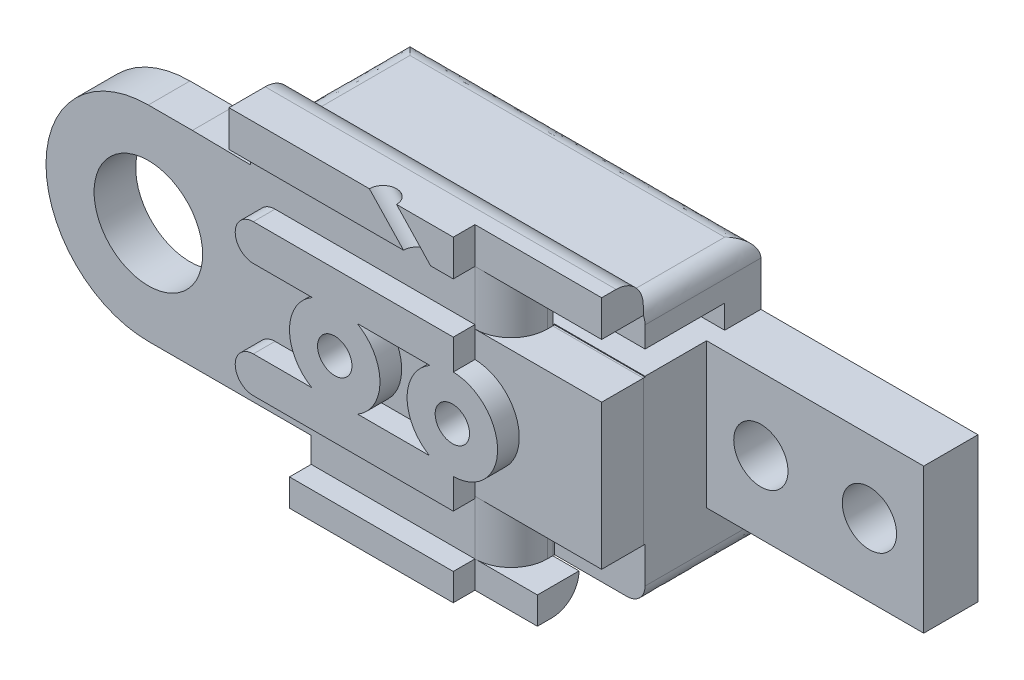
from build123d import *

# Parameters (mm, degrees)
BOSS_EXTRUDE1_DEPTH      = 2
BOSS_EXTRUDE6_DEPTH      = 4.5
CUT_EXTRUDE6_DEPTH       = 4.5
BOSS_EXTRUDE14_DEPTH     = 2.3
SKETCH32_R               = 3
CUT_EXTRUDE7_DEPTH       = 2.3
SKETCH33_W               = 12.393398282201806
SKETCH33_H               = 2.000000000000001
BOSS_EXTRUDE15_DEPTH     = 1.2
CUT_EXTRUDE8_DEPTH       = 2.4
SKETCH43_R               = 2.5000000000000004
SKETCH43_R_2             = 2.4999999999999982
BOSS_EXTRUDE17_DEPTH     = 1.2
CUT_EXTRUDE11_DEPTH      = 29.420773915365164
CUT_EXTRUDE11_DEPTH_BACK = 29.420773915365164
SKETCH44_R               = 0.9499999999999992
SKETCH44_R_2             = 0.9500000000000008
SKETCH49_R               = 0.7500000000000021
CUT_EXTRUDE13_DEPTH      = 3
FILLET1_R                = 1.5
FILLET3_START            = -1
FILLET3_DEPTH            = 8
FILLET3_START_2          = 5
FILLET3_2_DEPTH          = 21
FILLET3_3_DEPTH          = 8
SKETCH45_R               = 1.9999999999999996
SKETCH45_R_2             = 2.000000000000003
CUT_EXTRUDE15_DEPTH      = 4
FILLET4_R                = 2
BOSS_EXTRUDE18_DEPTH     = 12
SKETCH52_R               = 1.500000000000004
SKETCH52_R_2             = 1.5000000000000007
CUT_EXTRUDE16_DEPTH      = 12


with BuildPart() as part:
    # Sketch3 → Boss-Extrude1 (new body)
    with BuildSketch(Plane.XY):
        with BuildLine():
            Line((8.000000000000002, 0), (8.999999999999995, -2.5431457505076205))
            Line((8.999999999999995, -2.5431457505076205), (8.999999999999995, -7.043145750507605))
            Line((8.999999999999995, -7.043145750507605), (21.50000000000004, -7.043145750507604))
            Line((21.50000000000004, -7.043145750507604), (25.05025253169418, -7.043145750507604))
            Line((25.05025253169418, -7.043145750507604), (25.050252531694177, 7.456854249492383))
            Line((25.050252531694177, 7.456854249492383), (5.656854249492373, 7.456854249492379))
            Line((5.656854249492373, 7.456854249492379), (5.656854249492376, 5.656854249492382))
            ThreePointArc((5.656854249492376, 5.656854249492382), (7.391036260090296, 3.061467458920721), (8.000000000000002, 0))
        make_face()
    extrude(amount=BOSS_EXTRUDE1_DEPTH)

    # Sketch22 → Boss-Extrude6 (add)
    with BuildSketch(Plane.XY.offset(2)):
        with BuildLine():
            Line((5.656854249492378, 7.456854249492383), (21.500000000000025, 7.456854249492383))
            Line((21.500000000000025, 7.456854249492383), (25.050252531694177, 7.456854249492383))
            Line((25.050252531694177, 7.456854249492383), (25.05025253169418, -7.043145750507604))
            Line((25.05025253169418, -7.043145750507604), (8.999999999999995, -7.043145750507605))
            Line((8.999999999999995, -7.043145750507605), (8.999999999999995, -2.5431457505076205))
            Line((8.999999999999995, -2.5431457505076205), (7.999999999999998, 0))
            ThreePointArc((7.999999999999998, 0), (7.391036260090291, 3.061467458920719), (5.656854249492376, 5.656854249492382))
            Line((5.656854249492376, 5.656854249492382), (5.656854249492378, 7.456854249492383))
        make_face()
    extrude(amount=BOSS_EXTRUDE6_DEPTH)

    # Sketch26 → Cut-Extrude6 (cut)
    with BuildSketch(Plane.XY.offset(2)):
        Polygon((18.098080447707712, 5.299999999999999), (2.5300524575164793, 5.299999999999999), (2.5300524575164793, 4), (18.098080447707712, 4), (25.05025253169419, 4.000000000000001), (25.05025253169419, 5.299999999999999), align=None)
    extrude(amount=CUT_EXTRUDE6_DEPTH, mode=Mode.SUBTRACT)


with BuildPart() as body_2:
    # Sketch31 → Boss-Extrude14 (new body)
    with BuildSketch(Plane.XY.offset(6.5)):
        with BuildLine():
            Line((2.4326880657739025, 5.656854247099344), (0.00016454221484158, 5.656854247099344))
            ThreePointArc((0.00016454221484158, 5.656854247099344), (-5.656854248894122, 8.227110743131e-05), (0, -5.656854249492382))
            Line((0, -5.656854249492382), (9.000000000000004, -5.656854249492382))
            Line((9.000000000000004, -5.656854249492382), (8.999999999999995, -7.043145750507605))
            Line((8.999999999999995, -7.043145750507605), (8.999999999999995, -8.543145750507605))
            Line((8.999999999999995, -8.543145750507605), (21.50000000000004, -8.543145750507605))
            Line((21.50000000000004, -8.543145750507605), (21.50000000000004, -7.043145750507605))
            Line((21.50000000000004, -7.043145750507605), (25.05025253169418, -7.043145750507604))
            Line((25.05025253169418, -7.043145750507604), (25.05025253169418, 8.956854249492379))
            Line((25.05025253169418, 8.956854249492379), (5.656854249492376, 8.956854249492379))
            Line((5.656854249492376, 8.956854249492379), (5.656854249492378, 7.456854249492383))
            Line((5.656854249492378, 7.456854249492383), (5.656854249492376, 5.613708498984764))
            Line((5.656854249492376, 5.613708498984764), (2.4326880657739025, 5.656854247099344))
        make_face()
    extrude(amount=BOSS_EXTRUDE14_DEPTH)

    # Sketch32 → Cut-Extrude7 (cut)
    with BuildSketch(Plane.XY.offset(8.799999999999999)):
        Circle(SKETCH32_R)
    extrude(amount=-CUT_EXTRUDE7_DEPTH, mode=Mode.SUBTRACT)

    # Sketch33 → Boss-Extrude15 (add)
    with BuildSketch(Plane.XY.offset(8.799999999999999)):
        with Locations((11.853553390593277, 7.956854249492379)):
            Rectangle(SKETCH33_W, SKETCH33_H)
        Polygon((9.000000000000004, -7.043145750507606), (9.000000000000004, -8.543145750507605), (18.05025253169418, -8.543145750507605), (18.05025253169418, -7.0431457505076045), align=None)
        with BuildLine():
            Line((7.000000000000003, -4.156854249492383), (18.05025253169419, -4.156854249492383))
            Line((18.05025253169419, -4.156854249492383), (18.05025253169419, -2.1568542494923824))
            Line((18.05025253169419, -2.1568542494923824), (7.000000000000003, -2.1568542494923832))
            ThreePointArc((7.000000000000003, -2.1568542494923832), (6.000000000000003, -3.1568542494923832), (7.000000000000003, -4.156854249492383))
        make_face()
        with BuildLine():
            Line((18.05025253169419, 2.172006245196199), (7.000000000000003, 2.172006245196201))
            ThreePointArc((7.000000000000003, 2.172006245196201), (6.0000000000000036, 3.1720062451962), (7.000000000000003, 4.172006245196199))
            Line((7.000000000000003, 4.172006245196199), (18.05025253169419, 4.172006245196199))
            Line((18.05025253169419, 4.172006245196199), (18.05025253169419, 2.172006245196199))
        make_face()
    extrude(amount=BOSS_EXTRUDE15_DEPTH)


with BuildPart() as cut_extrude8_tool:
    # Sketch35 → Cut-Extrude8 (new body)
    with BuildSketch(Plane.XY.offset(8.799999999999999)):
        Polygon((25.05025253169418, 3.956854249492379), (25.05025253169418, 6.9568542494923795), (20.05025253169418, 6.956854249492378), (20.05025253169418, 3.9568542494923773), align=None)
        Polygon((25.05025253169418, -7.043145750507604), (20.05025253169419, -7.0431457505076045), (20.05025253169419, -4.043145750507604), (25.05025253169418, -4.043145750507604), align=None)
    extrude(amount=-CUT_EXTRUDE8_DEPTH)


with BuildPart() as part_1:
    add(part.part)

    # Cut-Extrude8: cut by cut_extrude8_tool
    add(cut_extrude8_tool.part, mode=Mode.SUBTRACT)


with BuildPart() as body_2_1:
    add(body_2.part)

    # Cut-Extrude8: cut by cut_extrude8_tool
    add(cut_extrude8_tool.part, mode=Mode.SUBTRACT)

    # Sketch43 → Boss-Extrude17 (add)
    with BuildSketch(Plane.XY.offset(8.799999999999999)):
        with Locations((11.500000000000004, 0)):
            Circle(SKETCH43_R)
        with Locations((18.000000000000004, 0)):
            Circle(SKETCH43_R_2)
    extrude(amount=BOSS_EXTRUDE17_DEPTH)


with BuildPart() as cut_extrude11_tool:
    # Sketch44 → Cut-Extrude11 (new, two sides: drawn at the far end of the back side and taken through both)
    with BuildSketch(Plane.XY.offset(9.999999999999998).offset(-CUT_EXTRUDE11_DEPTH_BACK)):
        with Locations((11.500000000000004, 0)):
            Circle(SKETCH44_R)
        with Locations((18.000000000000004, 0)):
            Circle(SKETCH44_R_2)
    extrude(amount=CUT_EXTRUDE11_DEPTH + CUT_EXTRUDE11_DEPTH_BACK)


with BuildPart() as part_2:
    add(part_1.part)

    # Cut-Extrude11: cut by cut_extrude11_tool
    add(cut_extrude11_tool.part, mode=Mode.SUBTRACT)

    # Fillet3: read off the stored shape, not the designer's step
    # Fillet3 outline → Fillet3 (cut)
    with BuildSketch(Plane.XY.offset(FILLET3_START)):
        with BuildLine():
            Line((9, -7.043145751), (10, -7.043145751))
            add(Edge.make_bspline(
                [(10, -7.043145751), (8.99999999999999, -7.043145750507609), (9, -6.043145751)],
                knots=[0, 0, 0, 1, 1, 1], degree=2, weights=[1, 0.7071067811865481, 1]))
            Line((9, -6.043145751), (9, -7.043145751))
        make_face()
        with BuildLine():
            Line((5.656854249, 7.456854249), (5.656854249, 6.456854249))
            add(Edge.make_bspline(
                [(5.656854249, 6.456854249), (5.656854249492369, 7.4568542494923795), (6.656854249, 7.456854249)],
                knots=[0, 0, 0, 1, 1, 1], degree=2, weights=[1, 0.707106781186547, 1]))
            Line((6.656854249, 7.456854249), (5.656854249, 7.456854249))
        make_face()
    extrude(amount=FILLET3_DEPTH, mode=Mode.SUBTRACT)

    # Fillet3 2 outline → Fillet3 2 (cut)
    with BuildSketch(Plane.YZ.offset(FILLET3_START_2)):
        with BuildLine():
            Line((-7.043145751, 0), (-6.043145751, 0))
            add(Edge.make_bspline(
                [(-6.043145751, 0), (-7.0431457505076045, 0), (-7.043145751, 1)],
                knots=[0, 0, 0, 1, 1, 1], degree=2, weights=[1, 0.707106781186548, 1]))
            Line((-7.043145751, 1), (-7.043145751, 0))
        make_face()
        with BuildLine():
            add(Edge.make_bspline(
                [(6.456854249, 0), (7.456854249492381, 0), (7.456854249, 1)],
                knots=[0, 0, 0, 1, 1, 1], degree=2, weights=[1, 0.707106781186548, 1]))
            Line((6.456854249, 0), (7.456854249, 0))
            Line((7.456854249, 0), (7.456854249, 1))
        make_face()
    extrude(amount=FILLET3_2_DEPTH, mode=Mode.SUBTRACT)

    # Fillet3 3 outline → Fillet3 3 (cut)
    with BuildSketch(Plane.XY.offset(FILLET3_START)):
        with BuildLine():
            Line((25.050252532, -7.043145751), (25.050252532, -6.043145751))
            add(Edge.make_bspline(
                [(25.050252532, -6.043145751), (25.050252531694195, -7.0431457505076045), (24.050252532, -7.043145751)],
                knots=[0, 0, 0, 1, 1, 1], degree=2, weights=[1, 0.707106781186548, 1]))
            Line((24.050252532, -7.043145751), (25.050252532, -7.043145751))
        make_face()
        with BuildLine():
            Line((25.050252532, 6.456854249), (25.050252532, 7.456854249))
            Line((25.050252532, 7.456854249), (24.050252532, 7.456854249))
            add(Edge.make_bspline(
                [(24.050252532, 7.456854249), (24.23662286224227, 7.456854249492371), (24.442904569552457, 7.413222711328381), (24.646119560607424, 7.308816022097408), (24.808964717093836, 7.142726196138974), (24.971827345010716, 6.860639849810825), (25.01301948040526, 6.758429238057051), (25.038618001980854, 6.6546327736033515), (25.050252531694174, 6.553326631418876), (25.050252532, 6.456854249)],
                knots=[0, 0, 0, 0, 0, 0, 0.6589186227127712, 0.6589186227127712, 0.6589186227127712, 0.6589186227127712, 1.0000000000000395, 1.0000000000000395, 1.0000000000000395, 1.0000000000000395, 1.0000000000000395, 1.0000000000000395], degree=5, weights=[1, 1.0000000000000024, 0.9950915544751191, 0.9930584097693568, 0.9999999999999981, 1.0000000000000009, 0.9997935626898684, 0.9999244387002607, 0.9999999999999992, 1]))
        make_face()
    extrude(amount=FILLET3_3_DEPTH, mode=Mode.SUBTRACT)

    # Sketch45 → Cut-Extrude15 (cut)
    with BuildSketch(Plane(origin=(0, 0, 0), x_dir=(-1, 0, 0), z_dir=(0, 0, -1))):
        with Locations((-11.500000000000004, 0)):
            Circle(SKETCH45_R)
        with Locations((-18.000000000000004, 0)):
            Circle(SKETCH45_R_2)
    extrude(amount=-CUT_EXTRUDE15_DEPTH, mode=Mode.SUBTRACT)

    # Sketch51 → Boss-Extrude18 (add)
    with BuildSketch(Plane(origin=(25.05025253169418, 5.99e-15, 0), x_dir=(0, 0, -1), z_dir=(1, 2.4e-16, 0))):
        Polygon((-9.5e-16, 3.9999999999999947), (3e-17, -4.000000000000005), (-3, -4.000000000000005), (-3.000000000000001, 3.9999999999999942), align=None)
    extrude(amount=BOSS_EXTRUDE18_DEPTH)

    # Sketch52 → Cut-Extrude16 (cut)
    with BuildSketch(Plane(origin=(0, 0, 0), x_dir=(-1, 0, 0), z_dir=(0, 0, -1))):
        with Locations((-34.05025253169418, 3.47e-15)):
            Circle(SKETCH52_R)
        with Locations((-28.05025253169418, 3.9e-15)):
            Circle(SKETCH52_R_2)
    extrude(amount=-CUT_EXTRUDE16_DEPTH, mode=Mode.SUBTRACT)


with BuildPart() as body_2_2:
    add(body_2_1.part)

    # Cut-Extrude11: cut by cut_extrude11_tool
    add(cut_extrude11_tool.part, mode=Mode.SUBTRACT)

    # Sketch49 → Cut-Extrude13 (cut, along a direction that is not the sketch's normal)
    with BuildSketch(Plane.XZ.offset(-6.956854249492379)):
        with Locations((16.05025253169419, 9.999999999999998)):
            Circle(SKETCH49_R)
    extrude(amount=-CUT_EXTRUDE13_DEPTH, dir=(0.6858421465414155, -0.7277503349552398, 0), mode=Mode.SUBTRACT)

    # Fillet1
    fillet1_edges = [body_2_2.edges().sort_by_distance(p)[0] for p in [
        (15.353553390593278, 8.956854249492379, 6.5),
        (15.250000000000018, -8.543145750507605, 6.5),
    ]]
    fillet(fillet1_edges, radius=FILLET1_R)

    # Fillet4
    fillet4_edges = [body_2_2.edges().sort_by_distance(p)[0] for p in [
        (20.05025253169418, 5.456854249492378, 8.799999999999999),
        (20.05025253169419, -5.543145750507604, 8.799999999999999),
    ]]
    fillet(fillet4_edges, radius=FILLET4_R - 0.0001)  # a hair under: the kernel refuses the full size


solid = Compound([part_2.part, body_2_2.part])
